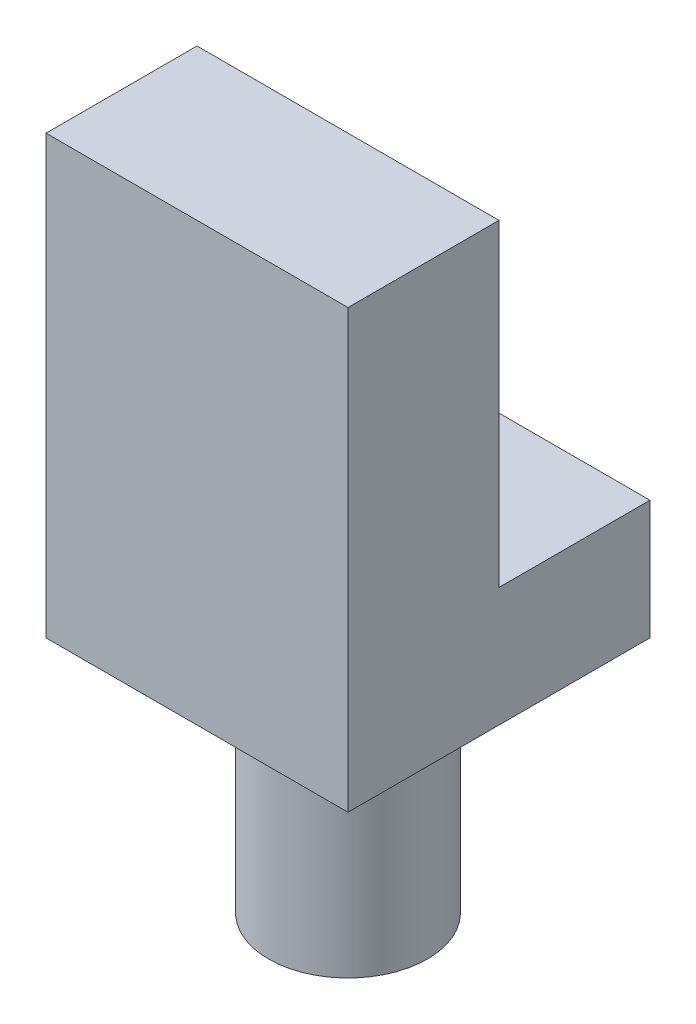
from build123d import *

# Parameters (mm, degrees)
SKETCH1_R           = 10
BOSS_EXTRUDE1_DEPTH = 30
SKETCH2_W           = 38
SKETCH2_H           = 38
BOSS_EXTRUDE2_DEPTH = 15
SKETCH3_W           = 38
SKETCH3_H           = 19
BOSS_EXTRUDE3_DEPTH = 40


with BuildPart() as part:
    # Sketch1 → Boss-Extrude1 (new body)
    with BuildSketch(Plane(origin=(0, 0, 0), x_dir=(1, 0, 0), z_dir=(0, 1, 0))):
        Circle(SKETCH1_R)
    extrude(amount=BOSS_EXTRUDE1_DEPTH)

    # Sketch2 → Boss-Extrude2 (add)
    with BuildSketch(Plane(origin=(0, 30, 0), x_dir=(1, 0, 0), z_dir=(0, 1, 0))):
        Rectangle(SKETCH2_W, SKETCH2_H)
    extrude(amount=BOSS_EXTRUDE2_DEPTH)

    # Sketch3 → Boss-Extrude3 (add)
    with BuildSketch(Plane(origin=(0, 45, 0), x_dir=(1, 0, 0), z_dir=(0, 1, 0))):
        with Locations((0, -9.5)):
            Rectangle(SKETCH3_W, SKETCH3_H)
    extrude(amount=BOSS_EXTRUDE3_DEPTH)


solid = part.part
